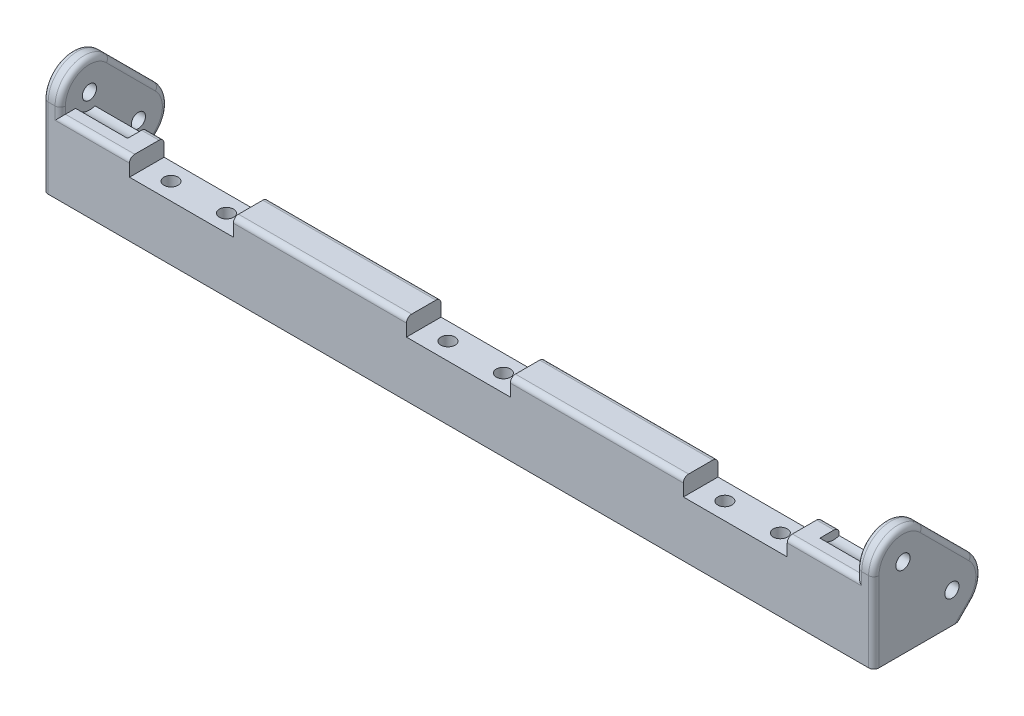
from build123d import *

# Parameters (mm, degrees)
BOSS_EXTRU_1_DEPTH      = 10
ESQUISSE6_R             = 2.05
ESQUISSE6_W             = 10
ESQUISSE6_H             = 21
BOSS_EXTRU_3_DEPTH      = 5
ESQUISSE4_R             = 2.05
ENL_V_MAT_EXTRU_2_DEPTH = 123.869849841
CONG_1_R                = 1.5
ESQUISSE8_R             = 2.05
ENL_V_MAT_EXTRU_4_DEPTH = 15


# Read off the part's stored shape, not the designer's step: Symétrie9
with BuildPart() as part:
    # Esquisse2 → Boss.-Extru.1 (new body)
    with BuildSketch(Plane.XY):
        Polygon((0, 0), (0, 16), (15, 16), (15, 21), (65, 21), (65, 16), (95, 16), (95, 21), (115, 21), (115, 0), align=None)
    extrude(amount=BOSS_EXTRU_1_DEPTH)

    # Esquisse6 → Boss.-Extru.3 (add)
    # profile 1 of 2: a face of its own
    with BuildSketch(Plane(origin=(115, 0, 0), x_dir=(0, 0, -1), z_dir=(1, 0, 0))):
        with BuildLine():
            Line((15.562445841, 0), (18.53122292, 2.96877708))
            ThreePointArc((18.53122292, 2.96877708), (21, 8.928932188), (18.53122292, 14.889087297))
            Line((18.53122292, 14.889087297), (4.389087297, 29.03122292))
            ThreePointArc((4.389087297, 29.03122292), (-4.796680513, 30.858385741), (-10, 23.071067812))
            Line((-10, 23.071067812), (-10, 21))
            Line((-10, 21), (0, 21))
            Line((0, 21), (0, 0))
            Line((0, 0), (15.562445841, 0))
        make_face()
        with Locations(Location((12.571067812, 8.928932188, 0), (0, 0, 90))):
            Circle(ESQUISSE6_R, mode=Mode.SUBTRACT)
        with Locations(Location((-1.571067812, 23.071067812, 0), (0, 0, 90))):
            Circle(ESQUISSE6_R, mode=Mode.SUBTRACT)
    # profile 2 of 2: a face of its own
    with BuildSketch(Plane(origin=(115, 0, 0), x_dir=(0, 0, -1), z_dir=(1, 0, 0))):
        with Locations((-5, 10.5)):
            Rectangle(ESQUISSE6_W, ESQUISSE6_H)
    extrude(amount=BOSS_EXTRU_3_DEPTH)

    # Esquisse4 → Enlèv. mat.-Extru.2 (cut, symmetric)
    with BuildSketch(Plane(origin=(0, 16, 0), x_dir=(1, 0, 0), z_dir=(0, 1, 0))):
        with Locations(Location((8, -5, 0), (0, 0, 180))):
            Circle(ESQUISSE4_R)
        with Locations(Location((72, -5, 0), (0, 0, 180))):
            Circle(ESQUISSE4_R)
        with Locations((88, -5)):
            Circle(ESQUISSE4_R)
    extrude(amount=ENL_V_MAT_EXTRU_2_DEPTH, both=True, mode=Mode.SUBTRACT)

    # Congé1
    cong_1_edges = [part.edges().sort_by_distance(p)[0] for p in [
        (40, 21, 0),
        (105, 21, 10),
        (105, 21, 0),
        (40, 21, 10),
        (115, 21.960155108, -11.460155108),
        (115, 8.928932188, -21),
        (115, 1.48438854, -17.04683438),
        (115, 22.035533906, 10),
        (120, 1.48438854, -17.04683438),
        (120, 8.928932188, -21),
        (120, 21.960155108, -11.460155108),
        (115, 30.858385741, 4.796680513),
        (120, 11.535533906, 10),
        (120, 30.858385741, 4.796680513),
    ]]
    fillet(cong_1_edges, radius=CONG_1_R)

    # Esquisse8 → Enlèv. mat.-Extru.4 (cut)
    # profile 1 of 2: a face of its own
    with BuildSketch(Plane.ZY.offset(-115)):
        with BuildLine():
            ThreePointArc((0, 19.5), (0.439339828, 20.560660172), (1.5, 21))
            Line((1.5, 21), (5.566149553, 21))
            ThreePointArc((5.566149553, 21), (5.943016338, 22.005203804), (6.071067812, 23.071067812))
            ThreePointArc((6.071067812, 23.071067812), (-0.996050694, 26.766998355), (0, 18.85422706))
            Line((0, 18.85422706), (0, 19.5))
        make_face()
        with Locations(Location((1.571067812, 23.071067812, 0), (0, 0, 90))):
            Circle(ESQUISSE8_R, mode=Mode.SUBTRACT)
    # profile 2 of 2: a face of its own
    with BuildSketch(Plane.ZY.offset(-115)):
        with BuildLine():
            Line((5.566149553, 21), (1.5, 21))
            ThreePointArc((1.5, 21), (0.439339828, 20.560660172), (0, 19.5))
            Line((0, 19.5), (0, 18.85422706))
            ThreePointArc((0, 18.85422706), (3.189723507, 18.872263966), (5.566149553, 21))
        make_face()
    extrude(amount=ENL_V_MAT_EXTRU_4_DEPTH, mode=Mode.SUBTRACT)

    # Symétrie9: part across plane


with BuildPart() as part_1:
    add(part.part)
    add(part.part.mirror(Plane(origin=(0, 0, 10), x_dir=(0, 0, 1), z_dir=(1, 0, 0))))


solid = part_1.part
